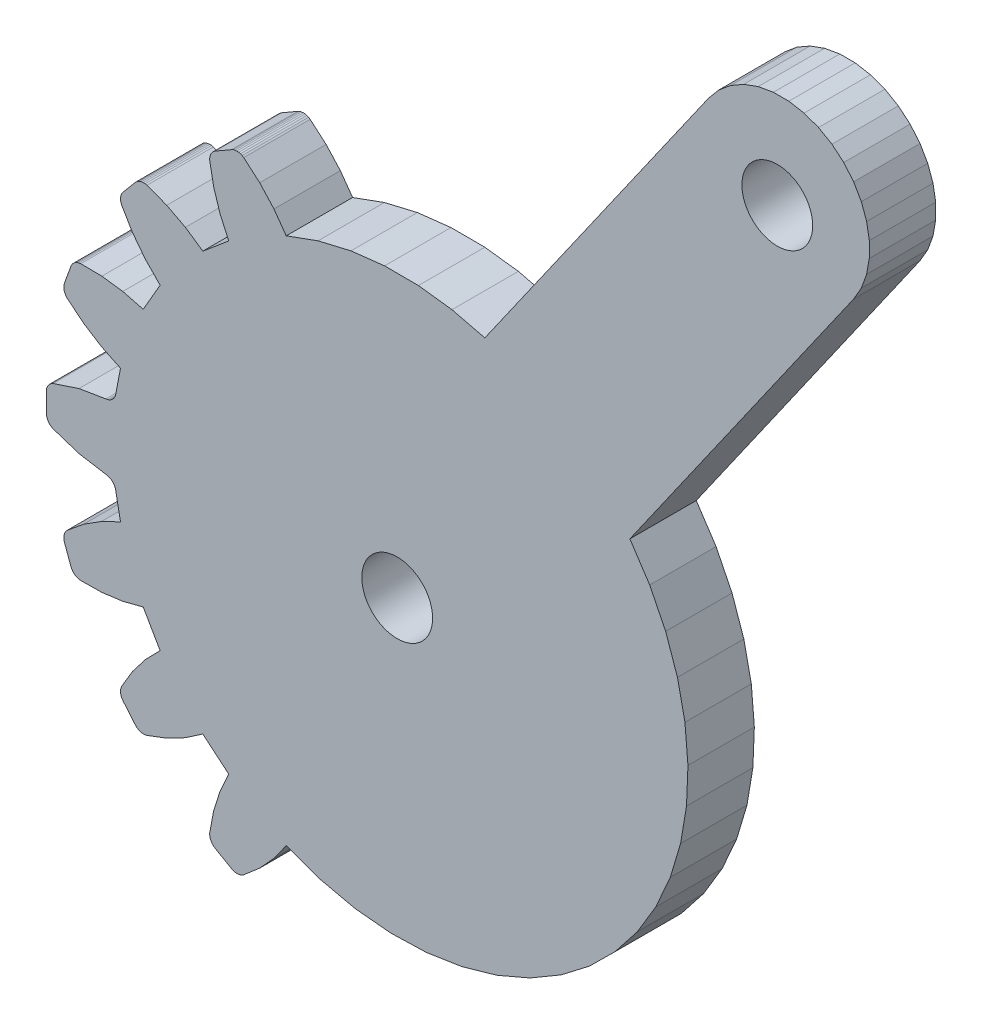
from build123d import *

# Parameters (mm, degrees)
BOSS_EXTRUDE1_DEPTH  = 3.000000026
SKETCH2_R            = 2.749999522
BOSS_EXTRUDE2_DEPTH  = 3
M3_CLEARANCE_HOLE1_D = 3.2
SKETCH6_R            = 2.292313744
BOSS_EXTRUDE3_DEPTH  = 3
M3_CLEARANCE_HOLE2_D = 3.2


with BuildPart() as part:
    # Sketch1 → Boss-Extrude1 (new body)
    with BuildSketch(Plane.XY.offset(3.000000026)):
        Polygon((30.938014388, 12.52672635), (30.993692577, 12.464644387), (31.038278714, 12.394173071), (31.070532277, 12.317270041), (31.089555472, 12.236077338), (31.302556396, 11.128782295), (30.442863703, 10.716496967), (29.638325796, 10.204861872), (28.900368139, 9.601146914), (28.843764216, 9.539354593), (28.798276559, 9.468976408), (28.765179217, 9.39199049), (28.745405376, 9.310557507), (28.739510104, 9.226966649), (28.747657314, 9.14356485), (28.7696179, 9.062694386), (29.060218483, 8.264278062), (29.095377773, 8.188211359), (29.142744839, 8.119084872), (29.200993478, 8.058840409), (29.268484563, 8.009170182), (29.343323782, 7.971468382), (29.42340821, 7.946795784), (29.506489635, 7.93584343), (30.459856614, 7.947720587), (31.405042857, 8.072933182), (32.328616828, 8.309704252), (33.093754202, 6.98444806), (32.426916063, 6.302993745), (31.84588626, 5.547046661), (31.358916312, 4.727343097), (31.326860189, 4.649917595), (31.308189034, 4.568225704), (31.303416938, 4.484563135), (31.312689185, 4.401278682), (31.335737556, 4.320711829), (31.371917576, 4.245125689), (31.420215964, 4.176644608), (31.966362149, 3.525769338), (32.025419176, 3.466315567), (32.093573362, 3.417558968), (32.168913633, 3.380868584), (32.249324024, 3.357278183), (32.332543284, 3.347447142), (32.416235656, 3.351651132), (32.498050481, 3.369776532), (33.389862627, 3.707006341), (34.235220402, 4.147941247), (35.022117198, 4.686314613), (36.194376647, 3.702674061), (35.800825804, 2.8342437), (35.51338613, 1.925161108), (35.336136818, 0.988340005), (35.332497209, 0.904619694), (35.342887044, 0.821467547), (35.367019475, 0.741219148), (35.404216498, 0.666126609), (35.453431308, 0.598302111), (35.513281822, 0.53964922), (35.582087934, 0.49181655), (36.317910999, 0.06698817), (36.393739283, 0.031316653), (36.474458873, 0.008810312), (36.557804793, 0.000102445), (36.641433835, 0.005435199), (36.722999066, 0.024659559), (36.800205708, 0.057237223), (36.870889366, 0.102249905), (37.593577057, 0.724161044), (38.237147033, 1.427633688), (38.792453706, 2.202672884), (40.32099992, 1.652605715), (41.90621525, 1.297470182), (43.523345143, 1.14281103), (45.147135854, 1.191046089), (46.752236784, 1.441420987), (48.313576728, 1.890026149), (49.806777388, 2.529853955), (51.208522171, 3.35091725), (52.496917546, 4.340391606), (53.651850671, 5.482827313), (54.655283689, 6.760384887), (55.491548032, 8.153112605), (56.147586554, 9.639264084), (56.613150984, 11.195631698), (56.880973279, 12.79791072), (56.94686994, 14.421083033), (56.809812784, 16.039799899), (56.471943855, 17.628785223), (55.938538164, 19.163226709), (55.217925459, 20.619161427), (54.321356118, 21.973853931), (64.433902502, 36.416061223), (64.782522619, 37.019897252), (65.020993352, 37.675093859), (65.142072737, 38.361746818), (65.142072737, 39.058990777), (65.020993352, 39.745643735), (64.782522619, 40.400840342), (64.433902502, 41.004676372), (63.985720277, 41.538797319), (63.451595604, 41.986979544), (62.8477633, 42.335599661), (62.192570418, 42.574070394), (61.50591746, 42.695149779), (60.808669776, 42.695149779), (60.122016817, 42.574070394), (59.46682021, 42.335599661), (58.862987906, 41.986979544), (58.328863233, 41.538797319), (57.880684733, 41.004676372), (47.768142074, 26.562465355), (46.282790601, 26.924792677), (44.765174389, 27.11022459), (43.236281723, 27.116201818), (41.717261076, 26.942636818), (40.229123086, 26.591934264), (38.792453706, 26.068942621), (38.237147033, 26.84398368), (37.593577057, 27.547456324), (36.870889366, 28.169367462), (36.800205708, 28.214380145), (36.722999066, 28.246957809), (36.641433835, 28.266180307), (36.557804793, 28.271514922), (36.474458873, 28.262805194), (36.393739283, 28.240300715), (36.317910999, 28.204629198), (35.582087934, 27.779800817), (35.513281822, 27.731966227), (35.453431308, 27.673315257), (35.404216498, 27.605488896), (35.367019475, 27.53039822), (35.342887044, 27.450149879), (35.332497209, 27.366997674), (35.336136818, 27.283277363), (35.51338613, 26.346456259), (35.800825804, 25.437373668), (36.194376647, 24.568943307), (35.022117198, 23.585300893), (34.235220402, 24.123676121), (33.389862627, 24.564608932), (32.498050481, 24.901840836), (32.416235656, 24.919964373), (32.332543284, 24.924170226), (32.249324024, 24.914339185), (32.168913633, 24.890746921), (32.093573362, 24.8540584), (32.025419176, 24.8053018), (31.966362149, 24.74584803), (31.420215964, 24.094972759), (31.371917576, 24.026490748), (31.335737556, 23.950904608), (31.312689185, 23.870337754), (31.303416938, 23.787053302), (31.308189034, 23.703390732), (31.326860189, 23.621698841), (31.358916312, 23.544274271), (31.84588626, 22.724570706), (32.426916063, 21.968623623), (33.093754202, 21.287169307), (32.328616828, 19.961912185), (31.405042857, 20.198684186), (30.459856614, 20.323896781), (29.506489635, 20.335773006), (29.42340821, 20.324820653), (29.343323782, 20.300148055), (29.268484563, 20.262446254), (29.200993478, 20.212776959), (29.142744839, 20.152531564), (29.095377773, 20.083405077), (29.060218483, 20.007338375), (28.7696179, 19.208922982), (28.747657314, 19.128052518), (28.739510104, 19.044650719), (28.745405376, 18.96105893), (28.765179217, 18.879625946), (28.798276559, 18.80264096), (28.843764216, 18.732262775), (28.900368139, 18.670469522), (29.638325796, 18.066754565), (30.442863703, 17.55511947), (31.302556396, 17.142834142), (31.089555472, 16.035540029), (31.070532277, 15.954345465), (31.038278714, 15.877444297), (30.993692577, 15.80697298), (30.938014388, 15.744891018), (30.872792006, 15.692926943), (30.799839646, 15.65252617), (30.721187592, 15.624811873), (30.639022589, 15.610555187), (29.425321147, 15.408091247), (28.257027268, 15.021897852), (28.182702139, 14.983191155), (28.115887195, 14.932615682), (28.058454394, 14.871591702), (28.012022376, 14.801833779), (27.977891266, 14.725299552), (27.95702219, 14.644141309), (27.950000018, 14.560637064), (27.950000018, 13.710979372), (27.95702219, 13.627475128), (27.977891266, 13.546316884), (28.012022376, 13.469783589), (28.058454394, 13.400025666), (28.115887195, 13.339001685), (28.182702139, 13.288425282), (28.257027268, 13.249719515), (29.425321147, 12.863526121), (30.639022589, 12.661062181), (30.721187592, 12.646805495), (30.799839646, 12.619091198), (30.872792006, 12.578690425), align=None)
        Polygon((41.241779923, 13.658275828), (41.200000793, 14.135807753), (41.241779923, 14.61334154), (41.365846992, 15.076363459), (41.568428278, 15.510808676), (41.843377054, 15.903474763), (42.182333767, 16.242429614), (42.575001717, 16.51737839), (43.009445071, 16.719963402), (43.472468853, 16.84403047), (43.949998915, 16.885807738), (44.427532703, 16.84403047), (44.890556484, 16.719963402), (45.324999839, 16.51737839), (45.717667788, 16.242429614), (46.056620777, 15.903474763), (46.331569552, 15.510808676), (46.534154564, 15.076363459), (46.658221632, 14.61334154), (46.700000763, 14.135807753), (46.658221632, 13.658275828), (46.534154564, 13.195252977), (46.331569552, 12.760808691), (46.056620777, 12.368143536), (45.717667788, 12.029185891), (45.324999839, 11.754238978), (44.890556484, 11.551653966), (44.427532703, 11.427586898), (43.949998915, 11.385808699), (43.472468853, 11.427586898), (43.009445071, 11.551653966), (42.575001717, 11.754238978), (42.182333767, 12.029185891), (41.843377054, 12.368143536), (41.568428278, 12.760808691), (41.365846992, 13.195252977), align=None, mode=Mode.SUBTRACT)
        Polygon((60.788292438, 36.617651582), (60.430500656, 36.713525653), (60.094792396, 36.870066077), (59.791371226, 37.082523108), (59.529449791, 37.344448268), (59.316989034, 37.647869438), (59.160444885, 37.983577698), (59.064578265, 38.341365755), (59.032294899, 38.71037066), (59.064578265, 39.07937184), (59.160444885, 39.437159896), (59.316989034, 39.772868156), (59.529449791, 40.076293051), (59.791371226, 40.338214487), (60.094792396, 40.550671518), (60.430500656, 40.707215667), (60.788292438, 40.803086013), (61.157293618, 40.835369378), (61.526294798, 40.803086013), (61.884086579, 40.707215667), (62.21979484, 40.550671518), (62.523216009, 40.338214487), (62.78514117, 40.076293051), (62.997594476, 39.772868156), (63.154138625, 39.437159896), (63.250012696, 39.07937184), (63.282296062, 38.71037066), (63.250012696, 38.341365755), (63.154138625, 37.983577698), (62.997594476, 37.647869438), (62.78514117, 37.344448268), (62.523216009, 37.082523108), (62.21979484, 36.870066077), (61.884086579, 36.713525653), (61.526294798, 36.617651582), (61.157293618, 36.585368216), align=None, mode=Mode.SUBTRACT)
    extrude(amount=-BOSS_EXTRUDE1_DEPTH)


with BuildPart() as boss_extrude2_tool:
    # Sketch2 → Boss-Extrude2 (new body)
    with BuildSketch(Plane.XY.offset(3.000000026)):
        with Locations((43.950000778, 14.135807753)):
            Circle(SKETCH2_R)
    extrude(amount=-BOSS_EXTRUDE2_DEPTH)


with BuildPart() as part_1:
    add(part.part)


with BuildPart() as part_2:
    # Boss-Extrude2: joined with boss_extrude2_tool
    add(part_1.part.fuse(boss_extrude2_tool.part, tol=0.00001))

    # M3 Clearance Hole1 (through all)
    with Locations(Plane.XY.offset(3.000000026)):
        with Locations((43.807098048, 14.410130954)):
            Hole(M3_CLEARANCE_HOLE1_D / 2)

    # Sketch6 → Boss-Extrude3 (add)
    with BuildSketch(Plane.XY.offset(3.000000026)):
        with Locations((61.104180291, 38.786225952)):
            Circle(SKETCH6_R)
    extrude(amount=-BOSS_EXTRUDE3_DEPTH)

    # M3 Clearance Hole2 (through all)
    with Locations(Plane.XY.offset(3.000000026)):
        with Locations((60.984106125, 38.362099458)):
            Hole(M3_CLEARANCE_HOLE2_D / 2)


solid = part_2.part
